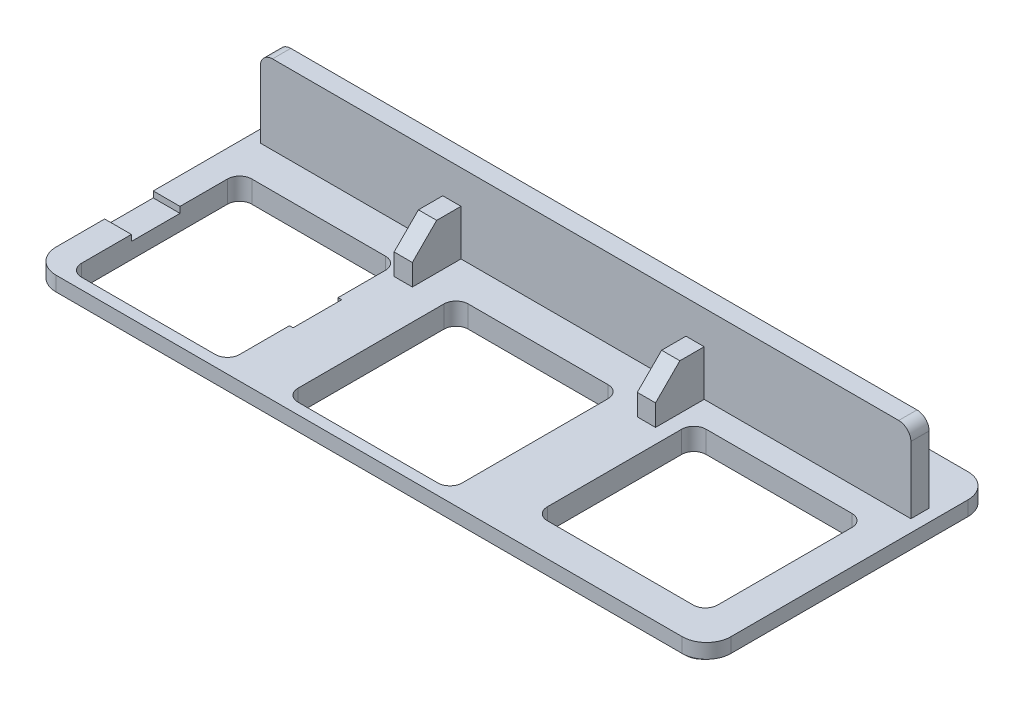
from build123d import *

# Parameters (mm, degrees)
SKETCH_1_W          = 55.5
SKETCH_1_H          = 23.5
EXTRUDE_1_DEPTH     = 1.2
FILLET_1_R          = 2
SKETCH_2_W          = 53.7
SKETCH_2_H          = 22.3
EXTRUDE_2_DEPTH     = 0.6
SKETCH_3_W          = 13
SKETCH_3_H          = 14
SKETCH_3_W_2        = 13.5
SKETCH_3_W_3        = 14
SKETCH_3_H_2        = 13.05
CUT_EXTRUDE_1_DEPTH = 3
FILLET_2_R          = 1
SKETCH_4_W          = 15.5
SKETCH_4_H          = 3.997435945
CUT_EXTRUDE_2_DEPTH = 0.5
SKETCH_5_W          = 53.5
SKETCH_5_H          = 1.5
EXTRUDE_3_DEPTH     = 6.5
FILLET_3_R          = 1
SKETCH_6_W          = 1.5
SKETCH_6_H          = 4
EXTRUDE_4_DEPTH     = 3.75
CHAMFER_1_SIZE      = 2
FILLET_4_R          = 1.5


with BuildPart() as part:
    # 草图1 → 凸台-拉伸1 (new body)
    with BuildSketch(Plane(origin=(0, 0, 0), x_dir=(1, 0, 0), z_dir=(0, 1, 0))):
        Rectangle(SKETCH_1_W, SKETCH_1_H)
    extrude(amount=EXTRUDE_1_DEPTH)

    # 圆角1
    fillet_1_edges = [part.edges().sort_by_distance(p)[0] for p in [
        (-27.75, 0.6, 11.75),
        (27.75, 0.6, 11.75),
        (-27.75, 0.6, -11.75),
        (27.75, 0.6, -11.75),
    ]]
    fillet(fillet_1_edges, radius=FILLET_1_R)

    # 草图2 → 凸台-拉伸2 (add)
    with BuildSketch(Plane.XZ):
        Rectangle(SKETCH_2_W, SKETCH_2_H)
    extrude(amount=EXTRUDE_2_DEPTH)

    # 草图3 → 切除-拉伸1 (cut)
    with BuildSketch(Plane.XZ.offset(0.6)):
        with Locations((-19.05, 3.85)):
            Rectangle(SKETCH_3_W, SKETCH_3_H)
        with Locations((-1, 3.85)):
            Rectangle(SKETCH_3_W_2, SKETCH_3_H)
        with Locations((17.95, 2.516421356)):
            Rectangle(SKETCH_3_W_3, SKETCH_3_H_2)
    extrude(amount=-CUT_EXTRUDE_1_DEPTH, mode=Mode.SUBTRACT)

    # 圆角2
    fillet_2_edges = [part.edges().sort_by_distance(p)[0] for p in [
        (-25.55, 0.3, 10.85),
        (-12.55, 0.3, 10.85),
        (-7.75, 0.3, 10.85),
        (5.75, 0.3, 10.85),
        (24.95, 0.3, 9.041421356),
        (10.95, 0.3, 9.041421356),
        (24.95, 0.3, -4.008578644),
        (10.95, 0.3, -4.008578644),
        (5.75, 0.3, -3.15),
        (-7.75, 0.3, -3.15),
        (-12.55, 0.3, -3.15),
        (-25.55, 0.3, -3.15),
    ]]
    fillet(fillet_2_edges, radius=FILLET_2_R)

    # 草图4 → 切除-拉伸2 (cut)
    with BuildSketch(Plane(origin=(0, 1.2, 0), x_dir=(1, 0, 0), z_dir=(0, 1, 0))):
        with Locations((-20, -3.751282028)):
            Rectangle(SKETCH_4_W, SKETCH_4_H)
    extrude(amount=-CUT_EXTRUDE_2_DEPTH, mode=Mode.SUBTRACT)

    # 草图5 → 凸台-拉伸3 (add)
    with BuildSketch(Plane(origin=(0, 1.2, 0), x_dir=(1, 0, 0), z_dir=(0, 1, 0))):
        with Locations((0, 6.804632487)):
            Rectangle(SKETCH_5_W, SKETCH_5_H)
    extrude(amount=EXTRUDE_3_DEPTH)

    # 圆角3
    fillet_3_edges = [part.edges().sort_by_distance(p)[0] for p in [
        (-26.75, 7.7, -6.804632487),
        (26.75, 7.7, -6.804632487),
    ]]
    fillet(fillet_3_edges, radius=FILLET_3_R)

    # 草图6 → 凸台-拉伸4 (add)
    with BuildSketch(Plane(origin=(0, 1.2, 0), x_dir=(1, 0, 0), z_dir=(0, 1, 0))):
        with Locations((9, 4.054632487)):
            Rectangle(SKETCH_6_W, SKETCH_6_H)
        with Locations((-11, 4.054632487)):
            Rectangle(SKETCH_6_W, SKETCH_6_H)
    extrude(amount=EXTRUDE_4_DEPTH)

    # 倒角1
    chamfer_1_edges = [part.edges().sort_by_distance(p)[0] for p in [
        (-11, 4.95, -2.054632487),
        (9, 4.95, -2.054632487),
    ]]
    chamfer(chamfer_1_edges, length=CHAMFER_1_SIZE)

    # 圆角4
    fillet_4_edges = [part.edges().sort_by_distance(p)[0] for p in [
        (-26.85, -0.3, -11.15),
        (26.85, -0.3, -11.15),
        (26.85, -0.3, 11.15),
        (-26.85, -0.3, 11.15),
    ]]
    fillet(fillet_4_edges, radius=FILLET_4_R)


solid = part.part
